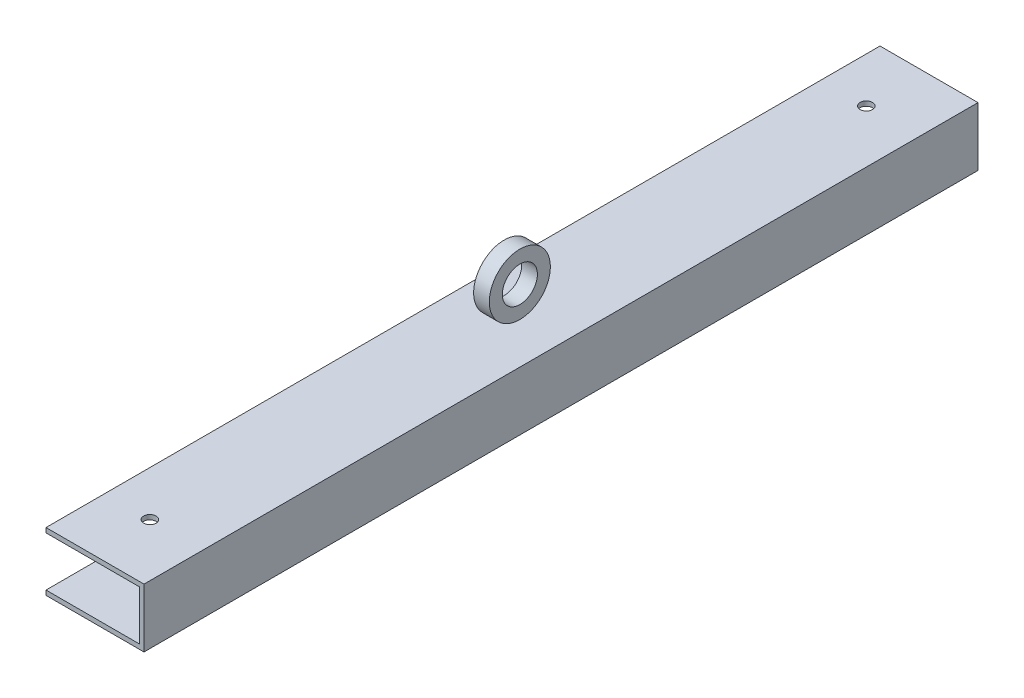
from build123d import *

# Parameters (mm, degrees)
CROQUIS2_W              = 100
CROQUIS2_H              = 60
SALIENTE_EXTRUIR1_DEPTH = 425.5
CROQUIS6_W              = 90.475
CROQUIS6_H              = 50.475
CORTAR_EXTRUIR1_DEPTH   = 900
CROQUIS7_W              = 851
CROQUIS7_H              = 50.475
CORTAR_EXTRUIR2_DEPTH   = 20
CROQUIS8_R              = 6.35
CORTAR_EXTRUIR3_DEPTH   = 80
CROQUIS9_R              = 31.15
CROQUIS9_R_2            = 17.9
SALIENTE_EXTRUIR2_DEPTH = 8


with BuildPart() as part:
    # Croquis2 → Saliente-Extruir1 (new, symmetric)
    with BuildSketch(Plane.XY):
        Rectangle(CROQUIS2_W, CROQUIS2_H)
    extrude(amount=SALIENTE_EXTRUIR1_DEPTH, both=True)

    # Croquis6 → Cortar-Extruir1 (cut)
    with BuildSketch(Plane.XY.offset(425.5)):
        Rectangle(CROQUIS6_W, CROQUIS6_H)
    extrude(amount=-CORTAR_EXTRUIR1_DEPTH, mode=Mode.SUBTRACT)

    # Croquis7 → Cortar-Extruir2 (cut)
    with BuildSketch(Plane.ZY.offset(50)):
        Rectangle(CROQUIS7_W, CROQUIS7_H)
    extrude(amount=-CORTAR_EXTRUIR2_DEPTH, mode=Mode.SUBTRACT)

    # Croquis8 → Cortar-Extruir3 (cut)
    with BuildSketch(Plane(origin=(0, 30, 0), x_dir=(1, 0, 0), z_dir=(0, 1, 0))):
        with Locations((-4, 365.5)):
            Circle(CROQUIS8_R)
        with Locations((-4, -365.5)):
            Circle(CROQUIS8_R)
    extrude(amount=-CORTAR_EXTRUIR3_DEPTH, mode=Mode.SUBTRACT)


with BuildPart() as body_2:
    # Croquis9 → Saliente-Extruir2 (new, symmetric)
    with BuildSketch(Plane(origin=(0, 0, 0), x_dir=(0, 0, -1), z_dir=(1, 0, 0))):
        with Locations((0, 61.15)):
            Circle(CROQUIS9_R)
        with Locations((0, 61.15)):
            Circle(CROQUIS9_R_2, mode=Mode.SUBTRACT)
    extrude(amount=SALIENTE_EXTRUIR2_DEPTH, both=True)


solid = Compound([part.part, body_2.part])
